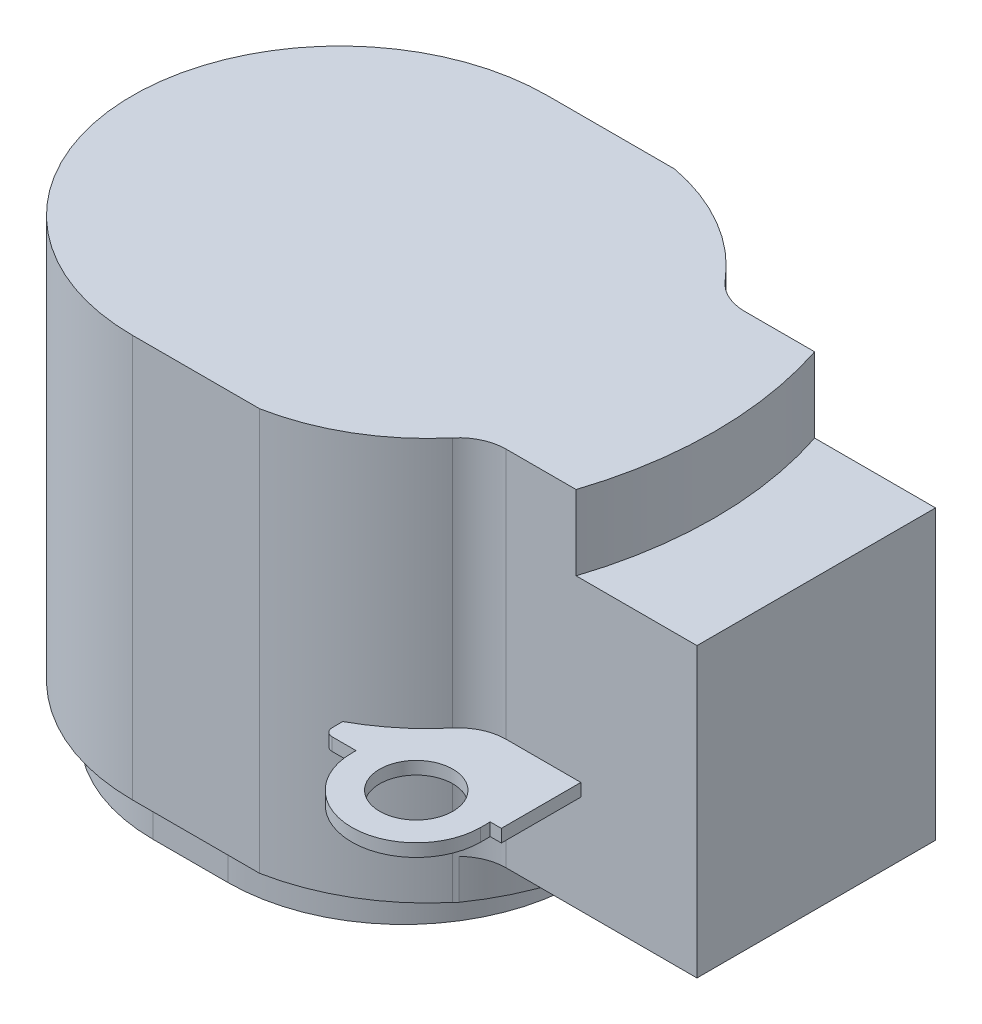
from build123d import *

# Parameters (mm, degrees)
BOSS_EXTRUDE1_DEPTH = 28.8
CUT_EXTRUDE1_DEPTH  = 41.90409515
BOSS_EXTRUDE3_DEPTH = 1
CUT_EXTRUDE2_DEPTH  = 4.7
SKETCH4_R           = 2.3
BOSS_EXTRUDE2_DEPTH = 0.8
SKETCH5_OUTSIDE_W   = 57.418
SKETCH5_OUTSIDE_H   = 48.718
CUT_EXTRUDE3_DEPTH  = 3.5
SKETCH6_OUTSIDE_W   = 57.418
SKETCH6_OUTSIDE_H   = 48.718
CUT_EXTRUDE4_DEPTH  = 2.5


with BuildPart() as part:
    # Sketch1 → Boss-Extrude1 (new body)
    with BuildSketch(Plane(origin=(0, 0, 0), x_dir=(1, 0, 0), z_dir=(0, 1, 0))):
        with BuildLine():
            Line((-4, 13.05), (4, 13.05))
            ThreePointArc((4, 13.05), (8.213640499, 11.465985784), (11.656602829, 8.566006872))
            ThreePointArc((11.656602829, 8.566006872), (12.685480206, 7.779523995), (13.95, 7.5))
            Line((13.95, 7.5), (25.95, 7.5))
            Line((25.95, 7.5), (25.95, -7.5))
            Line((25.95, -7.5), (13.95, -7.5))
            ThreePointArc((13.95, -7.5), (12.685480206, -7.779523995), (11.656602829, -8.566006872))
            ThreePointArc((11.656602829, -8.566006872), (8.213640499, -11.465985784), (4, -13.05))
            Line((4, -13.05), (-4, -13.05))
            ThreePointArc((-4, -13.05), (-17.05, 0), (-4, 13.05))
        make_face()
    extrude(amount=-BOSS_EXTRUDE1_DEPTH)

    # Sketch2 → Cut-Extrude1 (cut, through all)
    with BuildSketch(Plane(origin=(0, 0, 0), x_dir=(1, 0, 0), z_dir=(0, 1, 0))):
        with BuildLine():
            Line((0, -9.05), (-4.7, -9.05))
            ThreePointArc((-4.7, -9.05), (-13.75, 0), (-4.7, 9.05))
            Line((-4.7, 9.05), (0, 9.05))
            ThreePointArc((0, 9.05), (9.05, 0), (0, -9.05))
        make_face()
    extrude(amount=-CUT_EXTRUDE1_DEPTH, mode=Mode.SUBTRACT)

    # Sketch7 → Boss-Extrude3 (add)
    with BuildSketch(Plane(origin=(0, 0, 0), x_dir=(1, 0, 0), z_dir=(0, 1, 0))):
        with BuildLine():
            Line((-4.7, 10.05), (0, 10.05))
            ThreePointArc((0, 10.05), (10.05, 0), (0, -10.05))
            Line((0, -10.05), (-4.7, -10.05))
            ThreePointArc((-4.7, -10.05), (-14.75, 0), (-4.7, 10.05))
        make_face()
    extrude(amount=-BOSS_EXTRUDE3_DEPTH)

    # Sketch3 → Cut-Extrude2 (cut)
    with BuildSketch(Plane(origin=(0, 0, 0), x_dir=(1, 0, 0), z_dir=(0, 1, 0))):
        with BuildLine():
            Line((25.95, 7.5), (18.35, 7.5))
            ThreePointArc((18.35, 7.5), (19.55, 0), (18.35, -7.5))
            Line((18.35, -7.5), (25.95, -7.5))
            Line((25.95, -7.5), (25.95, 7.5))
        make_face()
    extrude(amount=-CUT_EXTRUDE2_DEPTH, mode=Mode.SUBTRACT)

    # Sketch4 → Boss-Extrude2 (add)
    with BuildSketch(Plane(origin=(0, -15.8, 0), x_dir=(1, 0, 0), z_dir=(0, 1, 0))):
        with BuildLine():
            Line((17.95, 12.5), (17.95, 13.1))
            ThreePointArc((17.95, 13.1), (13.9, 17.15), (9.85, 13.1))
            Line((9.85, 13.1), (9.85, 12.835141167))
            Line((9.85, 12.835141167), (8.35, 12.835141167))
            ThreePointArc((8.35, 12.835141167), (7.996446609, 12.688694558), (7.85, 12.335141167))
            Line((7.85, 12.335141167), (7.85, 10.106704765))
            Line((7.85, 10.106704765), (9.85, 10.106704765))
            Line((9.85, 10.106704765), (9.85, -10.106704765))
            Line((9.85, -10.106704765), (7.85, -10.106704765))
            Line((7.85, -10.106704765), (7.85, -12.335141167))
            ThreePointArc((7.85, -12.335141167), (7.996446609, -12.688694558), (8.35, -12.835141167))
            Line((8.35, -12.835141167), (9.85, -12.835141167))
            Line((9.85, -12.835141167), (9.85, -13.1))
            ThreePointArc((9.85, -13.1), (13.9, -17.15), (17.95, -13.1))
            Line((17.95, -13.1), (17.95, -12.5))
            Line((17.95, -12.5), (18.65, -12.5))
            Line((18.65, -12.5), (18.65, -6.668963251))
            Line((18.65, -6.668963251), (17.95, -6.668963251))
            Line((17.95, -6.668963251), (17.95, 6.668963251))
            Line((17.95, 6.668963251), (18.65, 6.668963251))
            Line((18.65, 6.668963251), (18.65, 12.5))
            Line((18.65, 12.5), (17.95, 12.5))
        make_face()
        with Locations((13.9, -13.1)):
            Circle(SKETCH4_R, mode=Mode.SUBTRACT)
        with Locations((13.9, 13.1)):
            Circle(SKETCH4_R, mode=Mode.SUBTRACT)
    extrude(amount=-BOSS_EXTRUDE2_DEPTH)

    # Sketch5 outside → Cut-Extrude3 (cut)
    # profile 1 of 2: a face of its own
    with BuildSketch(Plane.XZ.offset(28.8)):
        with Locations((4.45, 0)):
            Rectangle(SKETCH5_OUTSIDE_W, SKETCH5_OUTSIDE_H)
        with BuildLine():
            Line((0, 11.05), (-4.7, 11.05))
            ThreePointArc((-4.7, 11.05), (-15.75, 0), (-4.7, -11.05))
            Line((-4.7, -11.05), (0, -11.05))
            ThreePointArc((0, -11.05), (11.05, 0), (0, 11.05))
        make_face(mode=Mode.SUBTRACT)
    # profile 2 of 2: a face of its own
    with BuildSketch(Plane.XZ.offset(28.8)):
        with BuildLine():
            Line((-4.7, 9.05), (0, 9.05))
            ThreePointArc((0, 9.05), (9.05, 0), (0, -9.05))
            Line((0, -9.05), (-4.7, -9.05))
            ThreePointArc((-4.7, -9.05), (-13.75, 0), (-4.7, 9.05))
        make_face()
    extrude(amount=-CUT_EXTRUDE3_DEPTH, mode=Mode.SUBTRACT)

    # Sketch6 outside → Cut-Extrude4 (cut)
    with BuildSketch(Plane.XZ.offset(25.3)):
        with Locations((4.45, 0)):
            Rectangle(SKETCH6_OUTSIDE_W, SKETCH6_OUTSIDE_H)
        with BuildLine():
            Line((-0.915214063, 14.471830711), (-20.749472671, 14.471830711))
            Line((-20.749472671, 14.471830711), (-20.749472671, -14.500741391))
            Line((-20.749472671, -14.500741391), (0, -14.500741391))
            ThreePointArc((0, -14.500741391), (14.493511919, 0.457835289), (-0.915214063, 14.471830711))
        make_face(mode=Mode.SUBTRACT)
    extrude(amount=-CUT_EXTRUDE4_DEPTH, mode=Mode.SUBTRACT)


solid = part.part
